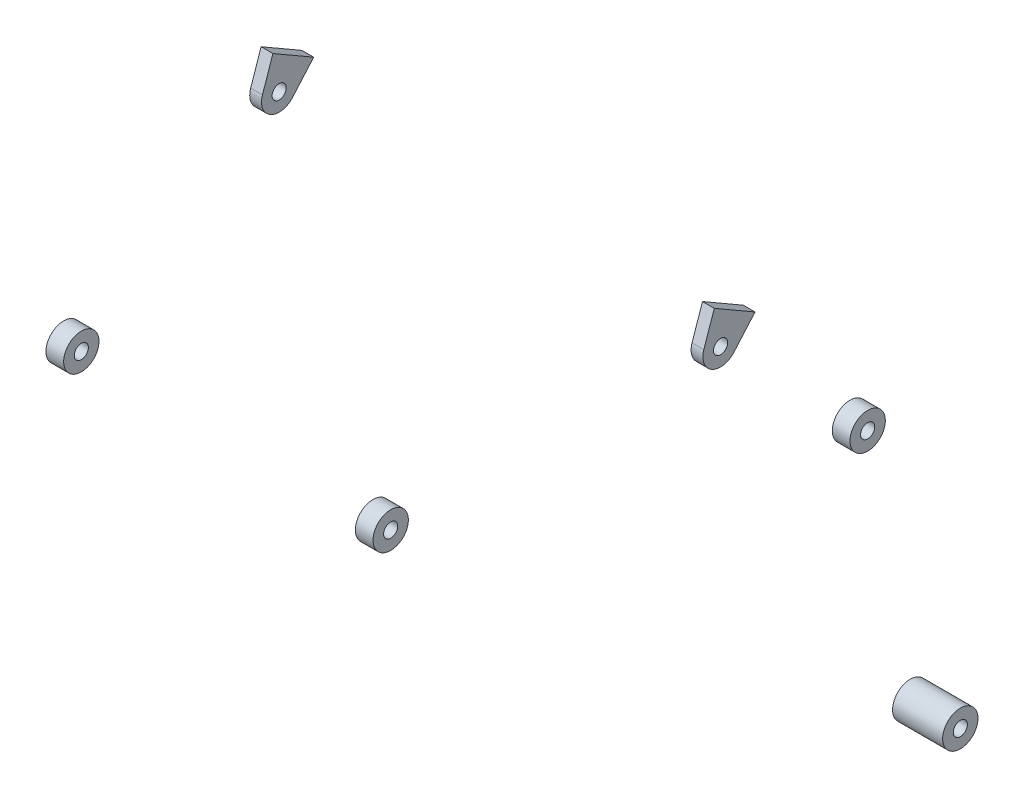
from build123d import *

# Parameters (mm, degrees)
SKETCH2_R           = 6
BOSS_EXTRUDE1_DEPTH = 10
SKETCH3_R           = 15
SKETCH3_R_2         = 6
BOSS_EXTRUDE2_DEPTH = 15
SKETCH5_R           = 15
SKETCH5_R_2         = 6
BOSS_EXTRUDE3_DEPTH = 42.5
SKETCH7_R           = 15
SKETCH7_R_2         = 6
BOSS_EXTRUDE4_DEPTH = 15


with BuildPart() as part:
    # Sketch2 → Boss-Extrude1 (new body)
    with BuildSketch(Plane(origin=(0, 0, 0), x_dir=(0, 0, -1), z_dir=(1, 0, 0))):
        with BuildLine():
            Line((-5.320508076, 30.784609691), (29.320508076, 10.784609691))
            Line((29.320508076, 10.784609691), (11.301534141, -9.862825461))
            ThreePointArc((11.301534141, -9.862825461), (-7.5, -12.990381057), (-14.192224472, 4.856002937))
            Line((-14.192224472, 4.856002937), (-5.320508076, 30.784609691))
        make_face()
        Circle(SKETCH2_R, mode=Mode.SUBTRACT)
    extrude(amount=BOSS_EXTRUDE1_DEPTH)


with BuildPart() as body_2:
    # Sketch3 → Boss-Extrude2 (new body)
    with BuildSketch(Plane(origin=(-43.5, 0, 0), x_dir=(0, 0, -1), z_dir=(1, 0, 0))):
        with Locations((-226.385122131, -48.394488094)):
            Circle(SKETCH3_R)
        with Locations((-226.385122131, -48.394488094)):
            Circle(SKETCH3_R_2, mode=Mode.SUBTRACT)
    extrude(amount=-BOSS_EXTRUDE2_DEPTH)


with BuildPart() as body_3:
    # Sketch5 → Boss-Extrude3 (new body)
    with BuildSketch(Plane(origin=(-72.5, 0, 0), x_dir=(0, 0, -1), z_dir=(1, 0, 0))):
        with Locations((243.45711943, -422.357745708)):
            Circle(SKETCH5_R)
        with Locations((243.45711943, -422.357745708)):
            Circle(SKETCH5_R_2, mode=Mode.SUBTRACT)
    extrude(amount=BOSS_EXTRUDE3_DEPTH)


with BuildPart() as body_4:
    # Sketch7 → Boss-Extrude4 (new body)
    with BuildSketch(Plane(origin=(-79.5, 0, 0), x_dir=(0, 0, -1), z_dir=(1, 0, 0))):
        with Locations((199.340679854, -198.760014478)):
            Circle(SKETCH7_R)
        with Locations((199.340679854, -198.760014478)):
            Circle(SKETCH7_R_2, mode=Mode.SUBTRACT)
    extrude(amount=BOSS_EXTRUDE4_DEPTH)


with BuildPart() as body_5:
    # Mirror5: mirrored copy
    add(body_2.part.mirror(Plane.ZY.offset(182.25)))


with BuildPart() as body_6:
    # Mirror5 2: mirrored copy
    add(part.part.mirror(Plane.ZY.offset(182.25)))


solid = Compound([part.part, body_2.part, body_3.part, body_4.part, body_5.part, body_6.part])
